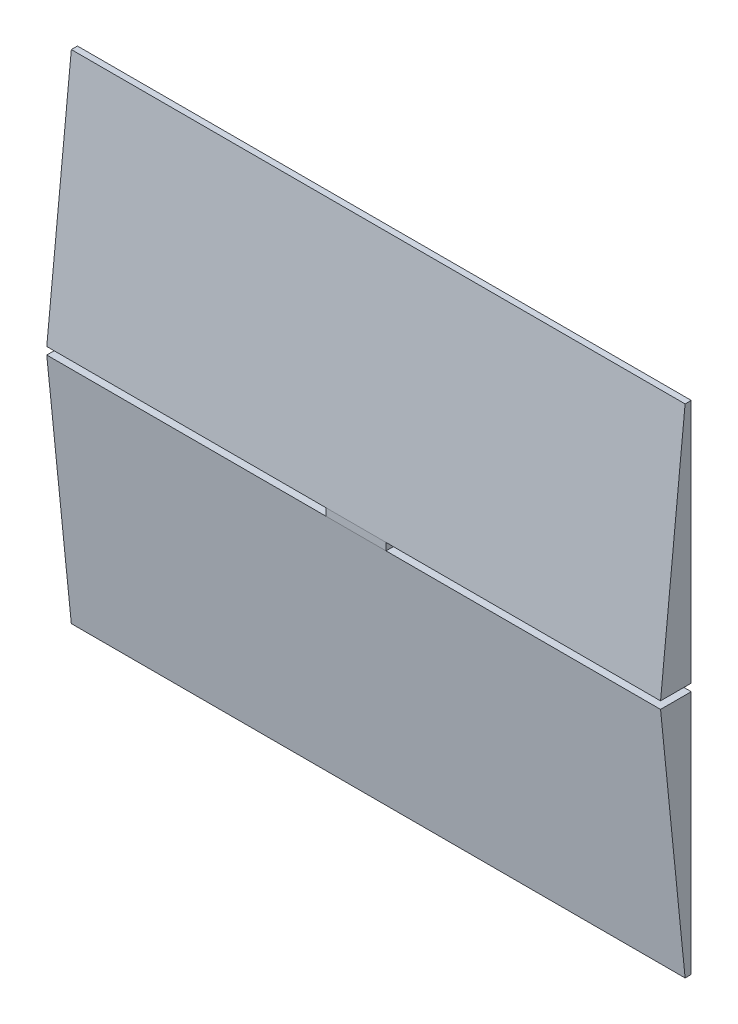
from build123d import *

# Parameters (mm, degrees)
DODANIE_WYCI_GNI_CIE1_DEPTH = 1
DODANIE_WYCI_GNI_CIE2_DEPTH = 100
SZKIC1_3_W                  = 9.8
SZKIC1_3_H                  = 0.6
DODANIE_WYCI_GNI_CIE3_DEPTH = 5


with BuildPart() as part:
    # Szkic1 → Dodanie-wyciągnięcie1 (new body)
    with BuildSketch(Plane.XY):
        Polygon((15.790798729, 11.214895549), (-29.683425952, 11.214895549), (-29.683425952, -28.685104451), (70.316574048, -28.685104451), (70.316574048, 11.214895549), (25.590798729, 11.214895549), (25.590798729, 11.814895549), (15.790798729, 11.814895549), align=None)
    extrude(amount=DODANIE_WYCI_GNI_CIE1_DEPTH)

    # Szkic2 → Dodanie-wyciągnięcie2 (add)
    with BuildSketch(Plane.ZY.offset(29.683425952)):
        Polygon((1, 11.214895549), (5, 11.214895549), (1, -28.685104451), align=None)
    extrude(amount=-DODANIE_WYCI_GNI_CIE2_DEPTH)

    # Szkic1<3> → Dodanie-wyciągnięcie3 (add)
    with BuildSketch(Plane.XY):
        with Locations((20.690798729, 11.514895549)):
            Rectangle(SZKIC1_3_W, SZKIC1_3_H)
    extrude(amount=DODANIE_WYCI_GNI_CIE3_DEPTH)

    # Lustro1: part across plane


with BuildPart() as part_1:
    add(part.part)
    add(part.part.mirror(Plane(origin=(25.590798729, 11.814895549, 1), x_dir=(0, 0, 1), z_dir=(0, -1, 0))))


solid = part_1.part
